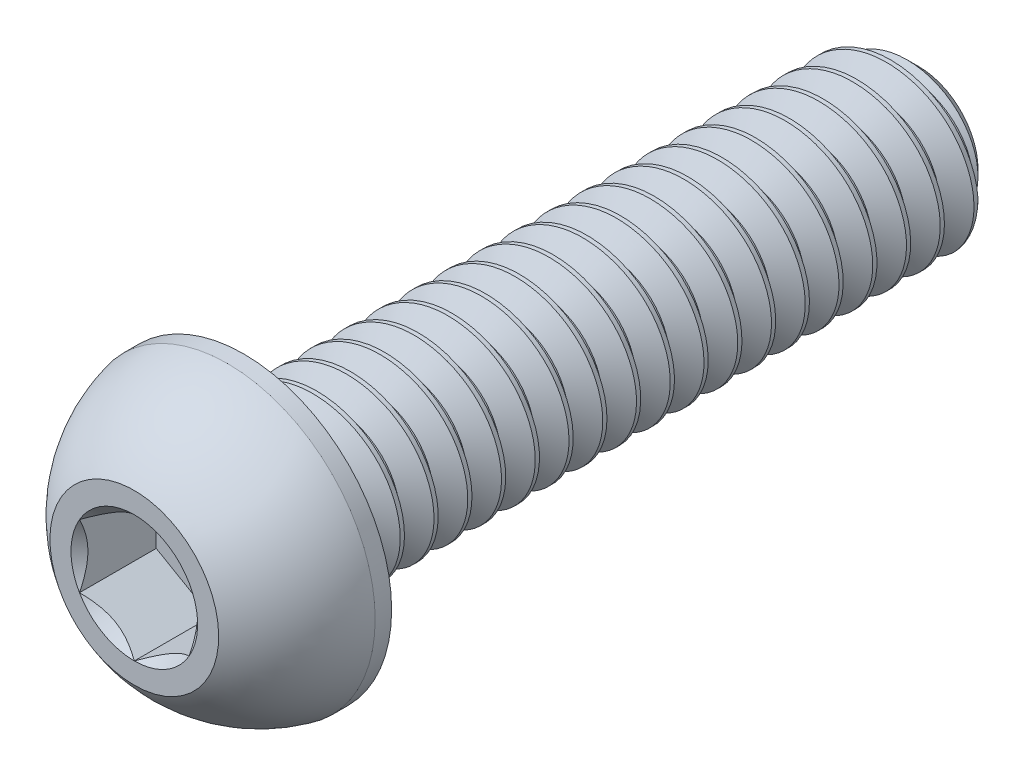
from build123d import *

# Parameters (mm, degrees)
SKETCH1_W          = 8
SKETCH1_H          = 1
CHAMFER1_SIZE      = 0.3
CUT_SWEEP1_PITCH   = 0.4
CUT_EXTRUDE2_DEPTH = 0.91


with BuildPart() as part:
    # Sketch1 → Revolve1 (revolve)
    with BuildSketch(Plane(origin=(0, 0, 0), x_dir=(0, 0, -1), z_dir=(1, 0, 0))):
        with Locations((5.3, 0.5)):
            Rectangle(SKETCH1_W, SKETCH1_H)
    revolve(axis=Axis((0, 0, -9.3), (0, 0, 1)))

    # Chamfer1
    chamfer1_edges = [part.edges().sort_by_distance(p)[0] for p in [
        (0, -1, -9.3),
    ]]
    chamfer(chamfer1_edges, length=CHAMFER1_SIZE)

    # Cut-Sweep1: the profile of Sketch2 profile screwed along a right-hand helix of 21 turns, 6 arcs to a turn; built about Z, then put on its axis
    cut_sweep1_z = Axis((0, 0, 0), (0, 0, 1))
    cut_sweep1_corners = [(1.0003, 0, 0.000173205), (1.0003, 0, -0.350173205), (0.740192379, 0, -0.2), (0.740192379, 0, -0.15)]
    with BuildLine(mode=Mode.PRIVATE) as cut_sweep1_profile:
        Line(cut_sweep1_corners[0], cut_sweep1_corners[1])
        Line(cut_sweep1_corners[1], cut_sweep1_corners[2])
        Line(cut_sweep1_corners[2], cut_sweep1_corners[3])
        Line(cut_sweep1_corners[3], cut_sweep1_corners[0])
    cut_sweep1_cap = Face(cut_sweep1_profile.wire())
    cut_sweep1_turn_angles = [0, 30, 60, 90, 120, 150, 180, 210, 240, 270, 300, 330, 360]
    cut_sweep1_turn_weights = [1, 0.8660254037844387, 1, 0.8660254037844387, 1, 0.8660254037844387, 1, 0.8660254037844387, 1, 0.8660254037844387, 1, 0.8660254037844387, 1]
    cut_sweep1_turn_rails = [Edge.make_bspline([Vector(p[0], p[1], 0).rotate(cut_sweep1_z, cut_sweep1_turn_angles[k]) / cut_sweep1_turn_weights[k] + Vector(0, 0, p[2] + CUT_SWEEP1_PITCH * cut_sweep1_turn_angles[k] / 360) for k in range(13)], [0, 0, 0, 1, 1, 2, 2, 3, 3, 4, 4, 5, 5, 6, 6, 6], 2, cut_sweep1_turn_weights) for p in cut_sweep1_corners]
    cut_sweep1_turn_sides = [Face.make_surface_from_curves(cut_sweep1_turn_rails[p[0]], cut_sweep1_turn_rails[p[1]]) for p in [(0, 1), (1, 2), (2, 3), (3, 0)]]
    cut_sweep1 = Plane(origin=(0, 0, -9.3), x_dir=(0, 1, 0), z_dir=(0, 0, 1)) * Solid(Shell([*[p.moved(Location((0, 0, CUT_SWEEP1_PITCH * i))) for i in range(21) for p in cut_sweep1_turn_sides], cut_sweep1_cap, cut_sweep1_cap.rotate(cut_sweep1_z, 7560).moved(Location((0, 0, CUT_SWEEP1_PITCH * 7560 / 360)))]))
    add(cut_sweep1, mode=Mode.SUBTRACT)

    # Sketch7 → Revolve2 (revolve)
    with BuildSketch(Plane(origin=(0, 0, 0), x_dir=(0, 0, -1), z_dir=(1, 0, 0)), mode=Mode.PRIVATE) as revolve2_sk:
        with BuildLine():
            Line((1.105, 1.75), (1.3, 1.75))
            Line((1.3, 1.75), (1.3, 0))
            Line((1.3, 0), (0, 0))
            Line((0, 0), (0, 1))
            ThreePointArc((0, 1), (0.479976957, 1.481850617), (1.105, 1.75))
        make_face()
    revolve(revolve2_sk.sketch.rotate(Axis((0, 0, 0), (0, 0, -1)), 189.336081704), axis=Axis((0, 0, 0), (0, 0, -1)))

    # Sketch5 → Cut-Extrude2 (cut)
    with BuildSketch(Plane.XY):
        Polygon((0.65, -0.375277675), (0.65, 0.375277675), (0, 0.75055535), (-0.65, 0.375277675), (-0.65, -0.375277675), (0, -0.75055535), align=None)
    extrude(amount=-CUT_EXTRUDE2_DEPTH, mode=Mode.SUBTRACT)

    # Cut-Extrude3 cone 1 section (through the dimple's axis) → Cut-Extrude3 (revolve, cut)
    with BuildSketch(Plane(origin=(0, 0, 0), x_dir=(0, -1, 0), z_dir=(1, 0, 0))):
        Polygon((0, 0), (0.75055535, 0), (0, 0.75055535), align=None)
    revolve(axis=Axis((0, 0, 0), (0, 0, -1)), mode=Mode.SUBTRACT)


solid = part.part
